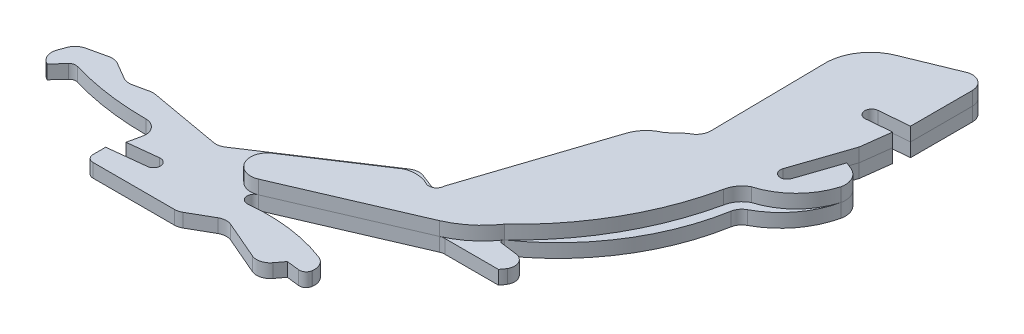
from build123d import *

# Parameters (mm, degrees)
BOSS_EXTRUDE1_DEPTH = 3
FILLET1_R           = 3
FILLET2_R           = 1.5
FILLET3_R           = 10
FILLET4_R           = 3
FILLET5_R           = 4
FILLET6_R           = 2.5
FILLET7_R           = 0.5
BOSS_EXTRUDE2_DEPTH = 3


with BuildPart() as part:
    # Sketch3 → Boss-Extrude1 (new body)
    with BuildSketch(Plane(origin=(0, 0, 0), x_dir=(1, 0, 0), z_dir=(0, 1, 0))):
        with BuildLine():
            Line((7.923093171, 8.181542538), (1.28839884, 7.442154357))
            Line((1.28839884, 7.442154357), (2.76822933, 14.19))
            ThreePointArc((2.76822933, 14.19), (-8.413807268, 14.494015924), (-19.359710867, 16.8))
            Line((-19.359710867, 16.8), (-22.216794933, 13.666296862))
            Line((-22.216794933, 13.666296862), (-24.820279869, 14.62298821))
            Line((-24.820279869, 14.62298821), (-22.646481841, 20.53863742))
            Line((-22.646481841, 20.53863742), (-15.703804617, 22.111794774))
            Line((-15.703804617, 22.111794774), (-10.073302156, 18.818482014))
            Line((-10.073302156, 18.818482014), (-5.186450964, 19.880840969))
            Line((-5.186450964, 19.880840969), (12.13, 16.8))
            Line((12.13, 16.8), (38.76, 34.29))
            Line((38.76, 34.29), (44.7, 32))
            Line((44.7, 32), (56.058554748, 66.4069852))
            Line((56.058554748, 66.4069852), (64.552315124, 69.756868371))
            Line((64.552315124, 69.756868371), (66.29, 103.00790875))
            Line((66.29, 103.00790875), (87.31, 111.63))
            Line((87.31, 111.63), (87.31, 93.591357519))
            Line((87.31, 93.591357519), (80.722672152, 93.01504101))
            ThreePointArc((80.722672152, 93.01504101), (79.359113719, 91.390015348), (80.984139381, 90.026456915))
            Line((80.984139381, 90.026456915), (86.46321022, 90.505813501))
            Line((86.46321022, 90.505813501), (85.632866314, 84))
            Line((85.632866314, 84), (81.389705108, 71.508585308))
            ThreePointArc((81.389705108, 71.508585308), (82.327545423, 69.605835839), (84.230294892, 70.543676154))
            Line((84.230294892, 70.543676154), (87.31, 79.61))
            Line((87.31, 79.61), (91.618486592, 77.887634392))
            ThreePointArc((91.618486592, 77.887634392), (88.600013238, 68.48894743), (80.984139381, 62.208424889))
            ThreePointArc((80.984139381, 62.208424889), (74.158506271, 43.709858628), (60.297831214, 29.686025056))
            Line((60.297831214, 29.686025056), (68.03871852, 28.66301442))
            ThreePointArc((68.03871852, 28.66301442), (67.586257486, 26.243028794), (66.29, 24.15))
            Line((66.29, 24.15), (54.05, 24.15))
            Line((54.05, 24.15), (25.830040494, 11.99))
            ThreePointArc((25.830040494, 11.99), (24.800734775, 10.253880031), (26.431506195, 9.064692331))
            ThreePointArc((26.431506195, 9.064692331), (36.664028635, 8.803570476), (46.46571567, 5.854056721))
            Line((46.46571567, 5.854056721), (45.9, 1.991540554))
            Line((45.9, 1.991540554), (41.660045255, 2.482673431))
            Line((41.660045255, 2.482673431), (38.9, -1.2))
            Line((38.9, -1.2), (27.015518097, 3.924692331))
            Line((27.015518097, 3.924692331), (20.16, 0))
            Line((20.16, 0), (0, 0))
            Line((0, 0), (0, 4.28))
            Line((0, 4.28), (8.255364291, 5.2))
            ThreePointArc((8.255364291, 5.2), (9.58, 6.856906829), (7.923093171, 8.181542538))
        make_face()
    extrude(amount=BOSS_EXTRUDE1_DEPTH)

    # Fillet1
    # the kernel refuses this fillet: 3 mm, written as the material it adds along each edge
    with BuildSketch(Plane(origin=(80.984139381, 0, -62.208424889), x_dir=(0.9022478681487618, 0, -0.4312177923289046), z_dir=(0, 1, 0))) as fillet1_piece_1:
        with BuildLine():
            CenterArc((1.578679862, -2.997421373), FILLET1_R, 92.37575888, 52.157589609)
            ThreePointArc((-0.864680258, -1.256734347), (-0.427200708, -0.631903288), (0, 0))
            ThreePointArc((0, 0), (0.72716053, -0.015077949), (1.45432106, 0))
        make_face()
    extrude(amount=3)
    with BuildSketch(Plane(origin=(27.015518097, 0, -3.924692331), x_dir=(0.9182659150547935, 0, 0.39596427774305953), z_dir=(0, 1, 0))) as fillet1_piece_2:
        with BuildLine():
            CenterArc((FILLET1_R * 0.49985366711, -FILLET1_R), FILLET1_R, 90, 53.116686758)
            Line((-FILLET1_R * 0.300005823165, -FILLET1_R * 0.399812699386), (0, 0))
            Line((0, 0), (FILLET1_R * 0.49985366711, 0))
        make_face()
    extrude(amount=3)
    with BuildSketch(Plane(origin=(12.13, 0, -16.8), x_dir=(-0.9845393680489544, 0, -0.17516344584919966), z_dir=(0, 1, 0))) as fillet1_piece_3:
        with BuildLine():
            CenterArc((FILLET1_R * 0.397788634748, -FILLET1_R), FILLET1_R, 90, 43.384200988)
            Line((-FILLET1_R * 0.289098500769, -FILLET1_R * 0.273235895863), (0, 0))
            Line((0, 0), (FILLET1_R * 0.397788634748, 0))
        make_face()
    extrude(amount=3)
    with BuildSketch(Plane(origin=(-10.073302156, 0, -18.818482014), x_dir=(-0.863187603129405, 0, -0.5048833150379528), z_dir=(0, 1, 0))) as fillet1_piece_4:
        with BuildLine():
            CenterArc((FILLET1_R * 0.389766900576, -FILLET1_R), FILLET1_R, 90, 42.58838059)
            Line((-FILLET1_R * 0.286959776942, -FILLET1_R * 0.263765659633), (0, 0))
            Line((0, 0), (FILLET1_R * 0.389766900576, 0))
        make_face()
    extrude(amount=3)
    with BuildSketch(Plane(origin=(2.76822933, 0, -14.19), x_dir=(-0.21421340809022724, 0, 0.9767868835085624), z_dir=(0, 1, 0))) as fillet1_piece_5:
        with BuildLine():
            CenterArc((3.855271405, -3), FILLET1_R, 90, 102.505548925)
            ThreePointArc((0.926446282, -3.649602493), (0.490902504, -1.81777488), (0, 0))
            Line((0, 0), (3.855271405, 0))
        make_face()
    extrude(amount=3)
    # the kernel refuses this fillet: 3 mm, written as the material it takes off along each edge
    with BuildSketch(Plane(origin=(-24.820279869, -7.478630688, -14.62298821), x_dir=(0.9386336815677853, 0, 0.3449156590044952), z_dir=(0, 1, 0))) as fillet1_2_piece_1:
        with BuildLine():
            CenterArc((3, 2.991452275), FILLET1_R, 180, 85.673811508)
            Line((0, 2.991452275), (0, 0))
            Line((0, 0), (2.773696477, 0))
        make_face()
    extrude(amount=17.957261376, mode=Mode.SUBTRACT)
    with BuildSketch(Plane(origin=(20.16, -1.994934097, 0), x_dir=(0.8678473261649016, 0, -0.4968309757537575), z_dir=(0, 1, 0))) as fillet1_2_piece_2:
        with BuildLine():
            CenterArc((FILLET1_R * 0.265991212876, FILLET1_R), FILLET1_R, 240.209440415, 29.790559585)
            Line((-FILLET1_R * 0.230839762878, FILLET1_R * 0.132152673835), (0, 0))
            Line((0, 0), (FILLET1_R * 0.265991212876, 0))
        make_face()
    extrude(amount=6.989868193, mode=Mode.SUBTRACT)
    with BuildSketch(Plane(origin=(46.46571567, -6.070952348, -5.854056721), x_dir=(-0.9233291277987619, 0, -0.38400953342121286), z_dir=(0, 1, 0))) as fillet1_2_piece_3:
        with BuildLine():
            CenterArc((2.333722575, 2.99850626), FILLET1_R, 194.249797413, 77.558344276)
            Line((-0.573972765, 2.260056662), (0, 0))
            ThreePointArc((0, 0), (1.21419047, -0.019160317), (2.428380939, 0))
        make_face()
    extrude(amount=15.141904695, mode=Mode.SUBTRACT)
    with BuildSketch(Plane(origin=(38.9, -5.909950036, 1.2), x_dir=(0.5997274231965581, 0, -0.8002043600643629), z_dir=(0, 1, 0))) as fillet1_2_piece_4:
        with BuildLine():
            CenterArc((FILLET1_R * 0.78799333809, FILLET1_R), FILLET1_R, 193.524251091, 76.475748909)
            Line((-FILLET1_R * 0.184277686804, FILLET1_R * 0.766143090435), (0, 0))
            Line((0, 0), (FILLET1_R * 0.78799333809, 0))
        make_face()
    extrude(amount=14.819900071, mode=Mode.SUBTRACT)
    with BuildSketch(Plane(origin=(38.76, -3.852720436, -34.29), x_dir=(-0.8358453893738872, 0, 0.5489649215226915), z_dir=(0, 1, 0))) as fillet1_2_piece_5:
        with BuildLine():
            CenterArc((FILLET1_R * 0.513696058133, FILLET1_R), FILLET1_R, 215.621225969, 54.378774031)
            Line((-FILLET1_R * 0.299188992069, FILLET1_R * 0.417575846005), (0, 0))
            Line((0, 0), (FILLET1_R * 0.513696058133, 0))
        make_face()
    extrude(amount=10.705440872, mode=Mode.SUBTRACT)
    with BuildSketch(Plane(origin=(-5.186450964, -1.481839662, -19.880840969), x_dir=(-0.9771763639228005, 0, 0.2124296443310458), z_dir=(0, 1, 0))) as fillet1_2_piece_6:
        with BuildLine():
            CenterArc((FILLET1_R * 0.197578621542, FILLET1_R), FILLET1_R, 247.647056489, 22.352943511)
            Line((-FILLET1_R * 0.18273230535, FILLET1_R * 0.0751413086926), (0, 0))
            Line((0, 0), (FILLET1_R * 0.197578621542, 0))
        make_face()
    extrude(amount=5.963679323, mode=Mode.SUBTRACT)
    with BuildSketch(Plane(origin=(-15.703804617, -2.961195523, -22.111794774), x_dir=(-0.975276058531981, 0, 0.22099006686800218), z_dir=(0, 1, 0))) as fillet1_2_piece_7:
        with BuildLine():
            CenterArc((FILLET1_R * 0.394826069747, FILLET1_R), FILLET1_R, 226.909202107, 43.090797893)
            Line((-FILLET1_R * 0.288330425897, FILLET1_R * 0.269727994197), (0, 0))
            Line((0, 0), (FILLET1_R * 0.394826069747, 0))
        make_face()
    extrude(amount=8.922391046, mode=Mode.SUBTRACT)
    with BuildSketch(Plane(origin=(-22.646481841, -4.076928403, -20.53863742), x_dir=(-0.3449156590044966, 0, 0.9386336815677849), z_dir=(0, 1, 0))) as fillet1_2_piece_8:
        with BuildLine():
            CenterArc((FILLET1_R * 0.543590453695, FILLET1_R), FILLET1_R, 212.943838396, 57.056161604)
            Line((-FILLET1_R * 0.295613569123, FILLET1_R * 0.456183295506), (0, 0))
            Line((0, 0), (FILLET1_R * 0.543590453695, 0))
        make_face()
    extrude(amount=11.153856805, mode=Mode.SUBTRACT)

    # Fillet2
    fillet2_edges = [part.edges().sort_by_distance(p)[0] for p in [
        (-19.359710867, 1.5, -16.8),
        (64.552315124, 1.5, -69.756868371),
        (45.9, 1.5, -1.991540554),
        (0, 1.5, 0),
    ]]
    fillet(fillet2_edges, radius=FILLET2_R)

    # Fillet3
    fillet3_edges = [part.edges().sort_by_distance(p)[0] for p in [
        (56.058554748, 1.5, -66.4069852),
        (66.29, 1.5, -103.00790875),
    ]]
    fillet(fillet3_edges, radius=FILLET3_R)

    # Fillet4
    fillet4_edges = [part.edges().sort_by_distance(p)[0] for p in [
        (87.31, 1.5, -111.63),
    ]]
    fillet(fillet4_edges, radius=FILLET4_R)

    # Fillet5
    fillet5_edges = [part.edges().sort_by_distance(p)[0] for p in [
        (91.618486592, 1.5, -77.887634392),
    ]]
    fillet(fillet5_edges, radius=FILLET5_R)

    # Fillet6
    fillet6_edges = [part.edges().sort_by_distance(p)[0] for p in [
        (68.03871852, 1.5, -28.66301442),
        (54.05, 1.5, -24.15),
    ]]
    fillet(fillet6_edges, radius=FILLET6_R)

    # Fillet7
    fillet7_edges = [part.edges().sort_by_distance(p)[0] for p in [
        (60.297831214, 1.5, -29.686025056),
    ]]
    fillet(fillet7_edges, radius=FILLET7_R)


with BuildPart() as body_2:
    # Sketch5 → Boss-Extrude2 (new body)
    with BuildSketch(Plane(origin=(0, 3, 0), x_dir=(1, 0, 0), z_dir=(0, 1, 0))):
        with BuildLine():
            Line((57.438647119, 61.017628386), (47.54878122, 31.059550342))
            ThreePointArc((47.54878122, 31.059550342), (46.745029323, 29.606678601), (45.085839693, 29.543883859))
            ThreePointArc((45.085839693, 29.543883859), (42.493298813, 30.251417888), (39.83722748, 29.84256866))
            Line((39.83722748, 29.84256866), (22.387718393, 18.382113763))
            ThreePointArc((22.387718393, 18.382113763), (21.1798426, 13.608693174), (25.830040494, 11.99))
            Line((25.830040494, 11.99), (53.576391709, 23.945921861))
            ThreePointArc((53.576391709, 23.945921861), (57.935166345, 26.636052739), (61.387868939, 30.41951217))
            ThreePointArc((61.387868939, 30.41951217), (72.399744721, 44.416938985), (78.775821887, 61.046280693))
            ThreePointArc((78.775821887, 61.046280693), (79.655985981, 63.123729699), (81.35980153, 64.602748217))
            ThreePointArc((81.35980153, 64.602748217), (87.51765004, 68.264170017), (91.181739197, 74.42043175))
            ThreePointArc((91.181739197, 74.42043175), (90.825596234, 77.169883499), (88.767430757, 79.027375787))
            Line((88.767430757, 79.027375787), (87.31, 79.61))
            Line((87.31, 79.61), (84.230294892, 70.543676154))
            ThreePointArc((84.230294892, 70.543676154), (82.327545423, 69.605835839), (81.389705108, 71.508585308))
            Line((81.389705108, 71.508585308), (85.632866314, 84))
            Line((85.632866314, 84), (86.46321022, 90.505813501))
            Line((86.46321022, 90.505813501), (80.984139381, 90.026456915))
            ThreePointArc((80.984139381, 90.026456915), (79.359113719, 91.390015348), (80.722672152, 93.01504101))
            Line((80.722672152, 93.01504101), (87.31, 93.591357519))
            Line((87.31, 93.591357519), (87.31, 107.156873665))
            ThreePointArc((87.31, 107.156873665), (85.981002826, 109.648409247), (83.171500296, 109.932448997))
            Line((83.171500296, 109.932448997), (72.150777993, 105.411912682))
            ThreePointArc((72.150777993, 105.411912682), (67.78888265, 101.944895464), (65.959404411, 96.681878387))
            Line((65.959404411, 96.681878387), (66.300336526, 70.631379716))
            ThreePointArc((66.300336526, 70.631379716), (65.702262854, 68.929518291), (64.278745649, 67.821536706))
            Line((64.278745649, 67.821536706), (61.517572524, 65.335095872))
            ThreePointArc((61.517572524, 65.335095872), (58.997486234, 63.630431041), (57.438647119, 61.017628386))
        make_face()
    extrude(amount=BOSS_EXTRUDE2_DEPTH)


solid = Compound([part.part, body_2.part])
